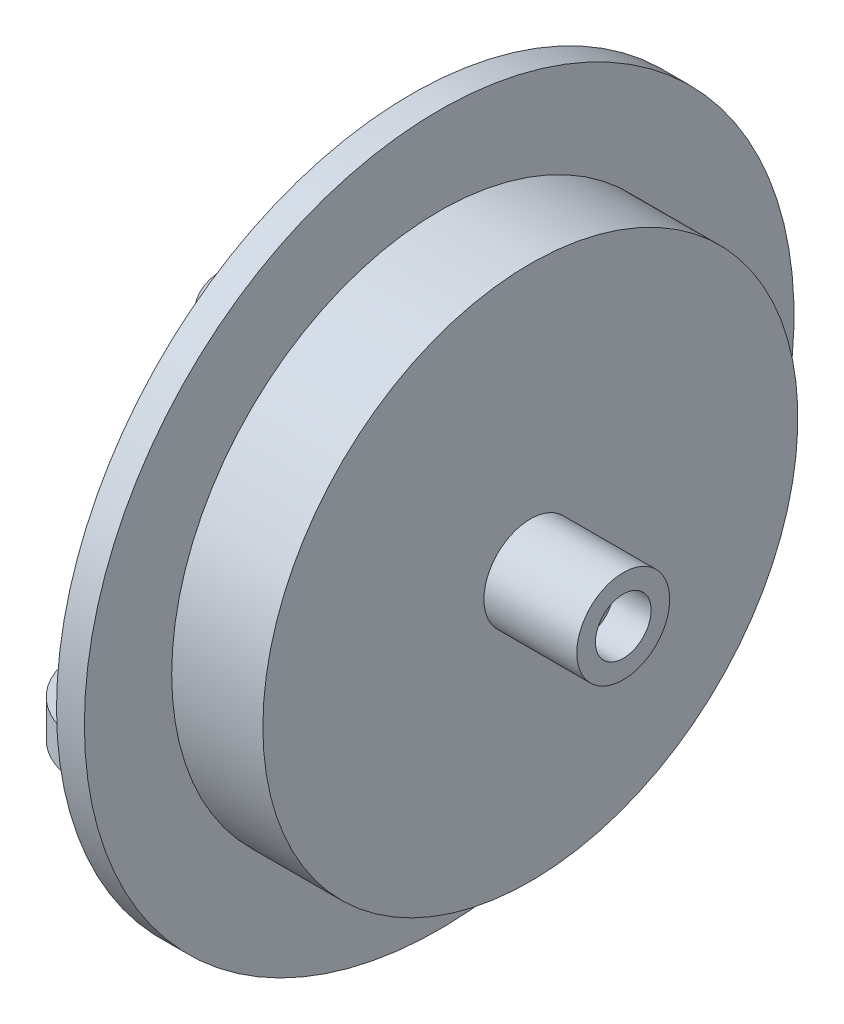
from build123d import *

# Parameters (mm, degrees)
SKETCH2_R           = 1
CUT_EXTRUDE1_DEPTH  = 30.321700517
SKETCH3_R           = 1.5
CUT_EXTRUDE2_DEPTH  = 2
SKETCH4_W           = 8
SKETCH4_H           = 2
BOSS_EXTRUDE1_DEPTH = 10
SKETCH6_R           = 1.25
CUT_EXTRUDE4_DEPTH  = 20
FILLET1_R           = 4
SKETCH7_W           = 6
SKETCH7_H           = 2
BOSS_EXTRUDE2_DEPTH = 12
SKETCH8_R           = 1.25
CUT_EXTRUDE5_DEPTH  = 12
FILLET2_R           = 4


with BuildPart() as part:
    # Sketch1 → Revolve1 (revolve)
    with BuildSketch(Plane(origin=(0, 0, 0), x_dir=(1, 0, 0), z_dir=(0, 1, 0)), mode=Mode.PRIVATE) as revolve1_sk:
        Polygon((0, 2.5), (0, 14.4), (-4.907984975, 14.4), (-4.907984975, 19.1), (-6.407984975, 19.1), (-6.407984975, 0), (0, 0), (5, 0), (5, 2.5), align=None)
    revolve(revolve1_sk.sketch.rotate(Axis((-25.527114743, 0, 0), (1, 0, 0)), 180), axis=Axis((-25.527114743, 0, 0), (1, 0, 0)))

    # Sketch2 → Cut-Extrude1 (cut, through all)
    with BuildSketch(Plane.ZY.offset(6.407984975)):
        Circle(SKETCH2_R)
    extrude(amount=-CUT_EXTRUDE1_DEPTH, mode=Mode.SUBTRACT)

    # Sketch3 → Cut-Extrude2 (cut)
    with BuildSketch(Plane(origin=(5, 0, 0), x_dir=(0, 0, -1), z_dir=(1, 0, 0))):
        Circle(SKETCH3_R)
    extrude(amount=-CUT_EXTRUDE2_DEPTH, mode=Mode.SUBTRACT)

    # Sketch4 → Boss-Extrude1 (add)
    with BuildSketch(Plane.ZY.offset(6.407984975)):
        with Locations((0, 5)):
            Rectangle(SKETCH4_W, SKETCH4_H)
        with Locations((0, -5)):
            Rectangle(SKETCH4_W, SKETCH4_H)
    extrude(amount=BOSS_EXTRUDE1_DEPTH)

    # Sketch6 → Cut-Extrude4 (cut)
    with BuildSketch(Plane(origin=(0, 6, 0), x_dir=(1, 0, 0), z_dir=(0, 1, 0))):
        with Locations(Location((-11.407984975, 0, 0), (0, 0, 270))):
            Circle(SKETCH6_R)
    extrude(amount=-CUT_EXTRUDE4_DEPTH, mode=Mode.SUBTRACT)

    # Fillet1
    fillet1_edges = [part.edges().sort_by_distance(p)[0] for p in [
        (-16.407984975, -5, 4),
        (-16.407984975, -5, -4),
        (-16.407984975, 5, 4),
        (-16.407984975, 5, -4),
    ]]
    fillet(fillet1_edges, radius=FILLET1_R - 0.0001)  # a hair under: the kernel refuses the full size

    # Sketch7 → Boss-Extrude2 (add)
    with BuildSketch(Plane.XY.offset(4)):
        with Locations((-9.407984975, -5)):
            Rectangle(SKETCH7_W, SKETCH7_H)
    extrude(amount=BOSS_EXTRUDE2_DEPTH)

    # Sketch8 → Cut-Extrude5 (cut)
    with BuildSketch(Plane(origin=(0, -4, 0), x_dir=(1, 0, 0), z_dir=(0, 1, 0))):
        with Locations(Location((-9.407984975, -13, 0), (0, 0, 270))):
            Circle(SKETCH8_R)
    extrude(amount=-CUT_EXTRUDE5_DEPTH, mode=Mode.SUBTRACT)

    # Fillet2
    fillet2_edges = [part.edges().sort_by_distance(p)[0] for p in [
        (-12.407984975, -5, 16),
    ]]
    fillet(fillet2_edges, radius=FILLET2_R)


solid = part.part
